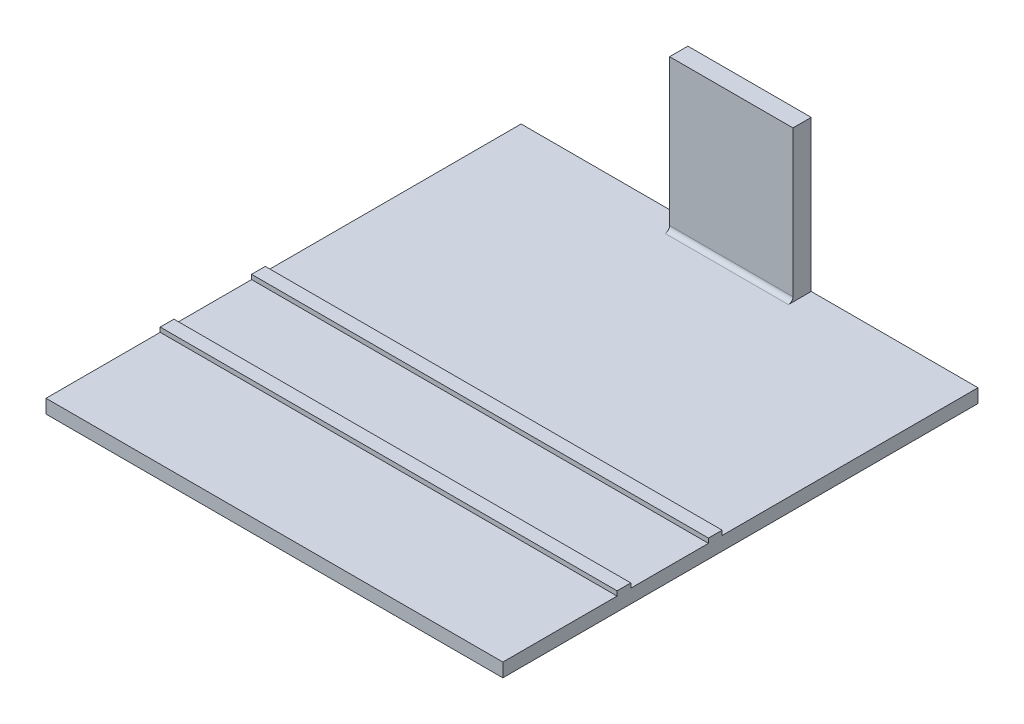
from build123d import *

# Parameters (mm, degrees)
SCHIZZO1_W                        = 27
SCHIZZO1_H                        = 36
ESTRUSIONE_ESTRUSIONE1_DEPTH      = 4
SCHIZZO3_W                        = 27
SCHIZZO3_H                        = 3
ESTRUSIONE_ESTRUSIONE2_DEPTH      = 100
RACCORDO1_R                       = 1
ESTRUSIONE_ESTRUSIONE3_DEPTH      = 36.5
ESTRUSIONE_ESTRUSIONE3_DEPTH_BACK = 63.5
SCHIZZO5_W                        = 104
SCHIZZO5_H                        = 3
SCHIZZO6_W                        = 3
SCHIZZO6_H                        = 1
ESTRUSIONE_ESTRUSIONE4_DEPTH      = 100


with BuildPart() as part:
    # Schizzo1 → Estrusione-Estrusione1 (new body)
    with BuildSketch(Plane.XY):
        with Locations((13.5, -18)):
            Rectangle(SCHIZZO1_W, SCHIZZO1_H)
    extrude(amount=ESTRUSIONE_ESTRUSIONE1_DEPTH)

    # Schizzo3 → Estrusione-Estrusione2 (add)
    with BuildSketch(Plane.XY.offset(4)):
        with Locations((13.5, -34.5)):
            Rectangle(SCHIZZO3_W, SCHIZZO3_H)
    extrude(amount=ESTRUSIONE_ESTRUSIONE2_DEPTH)

    # Raccordo1
    raccordo1_edges = [part.edges().sort_by_distance(p)[0] for p in [
        (13.5, -33, 4),
    ]]
    fillet(raccordo1_edges, radius=RACCORDO1_R)

    # Schizzo5 → Estrusione-Estrusione3 (add, two sides: drawn at the far end of the back side and taken through both)
    with BuildSketch(Plane(origin=(27, 0, 0), x_dir=(0, 0, -1), z_dir=(1, 0, 0)).offset(-ESTRUSIONE_ESTRUSIONE3_DEPTH_BACK)):
        with Locations((-52, -34.5)):
            Rectangle(SCHIZZO5_W, SCHIZZO5_H)
    extrude(amount=ESTRUSIONE_ESTRUSIONE3_DEPTH + ESTRUSIONE_ESTRUSIONE3_DEPTH_BACK)

    # Schizzo6 → Estrusione-Estrusione4 (add)
    with BuildSketch(Plane.ZY.offset(36.5)):
        with Locations((77.5, -32.5)):
            Rectangle(SCHIZZO6_W, SCHIZZO6_H)
        with Locations((57.5, -32.5)):
            Rectangle(SCHIZZO6_W, SCHIZZO6_H)
    extrude(amount=-ESTRUSIONE_ESTRUSIONE4_DEPTH)


solid = part.part
